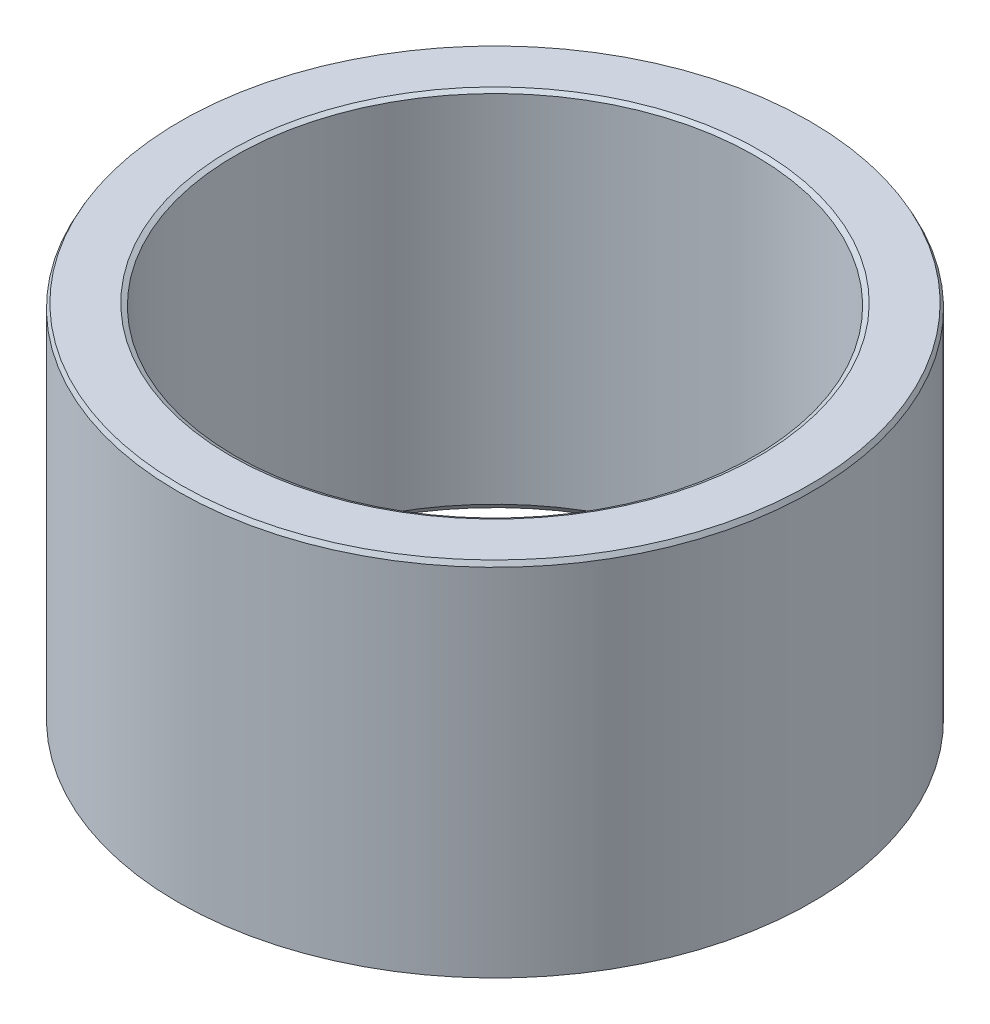
from build123d import *
from OCP.BRepFilletAPI import BRepFilletAPI_MakeChamfer

# Parameters (mm, degrees)
SKETCH1_R           = 35
BOSS_EXTRUDE1_DEPTH = 40.024708431
SKETCH2_R           = 28.685554381
CUT_EXTRUDE1_DEPTH  = 64.655143429
CHAMFER1_SIZE       = 0.51277898
CHAMFER1_SIZE2      = 0.266962145


with BuildPart() as part:
    # Sketch1 → Boss-Extrude1 (new body)
    with BuildSketch(Plane(origin=(0, 0, 0), x_dir=(1, 0, 0), z_dir=(0, 1, 0))):
        Circle(SKETCH1_R)
    extrude(amount=BOSS_EXTRUDE1_DEPTH)

    # Sketch2 → Cut-Extrude1 (cut, through all)
    with BuildSketch(Plane(origin=(0, 0, 0), x_dir=(1, 0, 0), z_dir=(0, 1, 0))):
        Circle(SKETCH2_R)
    extrude(amount=CUT_EXTRUDE1_DEPTH, mode=Mode.SUBTRACT)

    # Chamfer1: one chamfer whose edges measure the first distance from different faces: ONE call of the kernel's chamfer builder (chamfer() names one face for all edges)
    chamfer1_edges_1 = [part.edges().sort_by_distance(p)[0] for p in [
        (-28.685554381, 40.024708431, 0),
    ]]
    chamfer1_side_1 = [part.faces().sort_by_distance(p)[0] for p in [
        (-34.010050506, 40.024708431, 0),
    ]]
    chamfer1_edges_2 = [part.edges().sort_by_distance(p)[0] for p in [
        (-28.685554381, 0, 0),
    ]]
    chamfer1_side_2 = [part.faces().sort_by_distance(p)[0] for p in [
        (-28.685554381, 20.012354216, 0),
    ]]
    chamfer1_edges_3 = [part.edges().sort_by_distance(p)[0] for p in [
        (-35, 0, 0),
    ]]
    chamfer1_side_3 = [part.faces().sort_by_distance(p)[0] for p in [
        (-34.010050506, 0, 0),
    ]]
    chamfer1_edges_4 = [part.edges().sort_by_distance(p)[0] for p in [
        (-35, 40.024708431, 0),
    ]]
    chamfer1_side_4 = [part.faces().sort_by_distance(p)[0] for p in [
        (-35, 20.012354216, 0),
    ]]
    chamfer1 = BRepFilletAPI_MakeChamfer(part.part.solid().wrapped)
    for e in chamfer1_edges_1:
        chamfer1.Add(CHAMFER1_SIZE, CHAMFER1_SIZE2, e.wrapped, chamfer1_side_1[0].wrapped)  # the first distance lies on this face
    for e in chamfer1_edges_2:
        chamfer1.Add(CHAMFER1_SIZE, CHAMFER1_SIZE2, e.wrapped, chamfer1_side_2[0].wrapped)  # the first distance lies on this face
    for e in chamfer1_edges_3:
        chamfer1.Add(CHAMFER1_SIZE, CHAMFER1_SIZE2, e.wrapped, chamfer1_side_3[0].wrapped)  # the first distance lies on this face
    for e in chamfer1_edges_4:
        chamfer1.Add(CHAMFER1_SIZE, CHAMFER1_SIZE2, e.wrapped, chamfer1_side_4[0].wrapped)  # the first distance lies on this face
    add(Compound.cast(chamfer1.Shape()), mode=Mode.REPLACE)


solid = part.part
